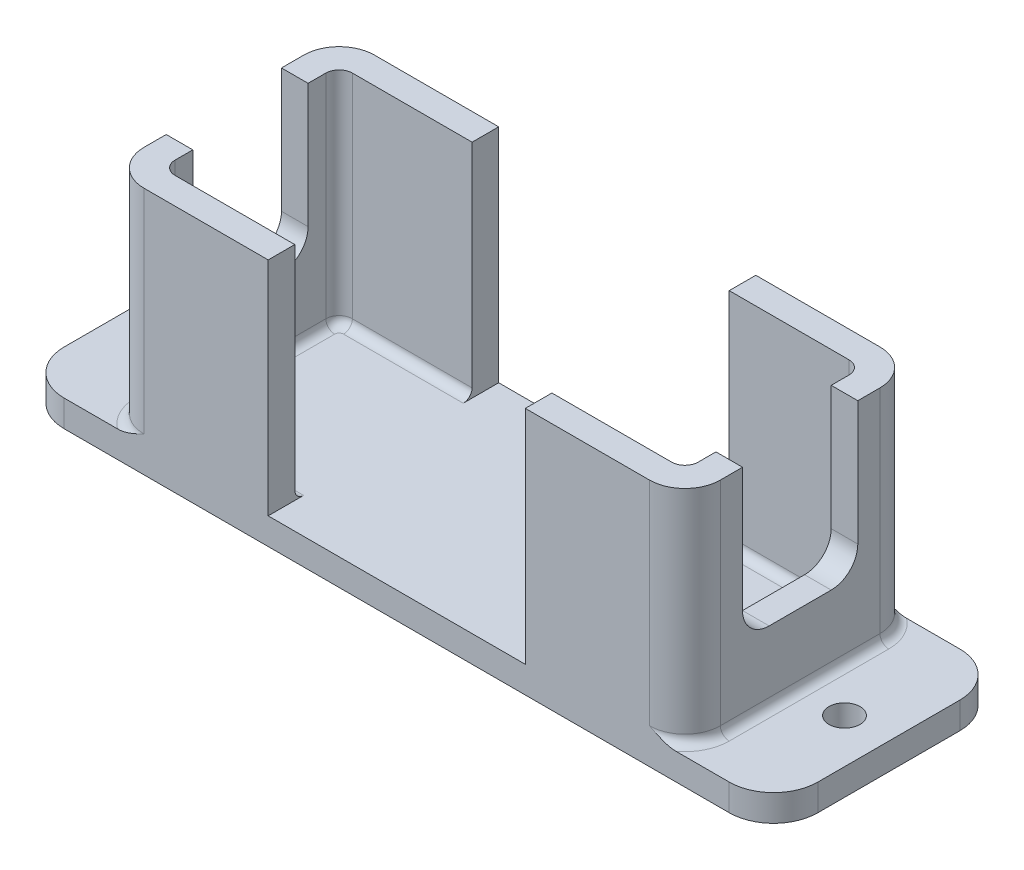
from build123d import *

# Parameters (mm, degrees)
SALIENTE_EXTRUIR1_DEPTH   = 25
SALIENTE_EXTRUIR1_2_DEPTH = 25
CROQUIS2_W                = 85
CROQUIS2_H                = 26
SALIENTE_EXTRUIR2_DEPTH   = 3
CROQUIS3_W                = 13
CROQUIS3_H                = 17
CORTAR_EXTRUIR2_DEPTH     = 81.118661996
REDONDEO1_R               = 5
REDONDEO2_R               = 3
REDONDEO3_R               = 3
REDONDEO4_R               = 1.5
REDONDEO5_R               = 4
REDONDEO6_R               = 4
REDONDEO7_R               = 1.5
CROQUIS5_R                = 1.75
CORTAR_EXTRUIR3_DEPTH     = 81.118661996
REDONDEO8_R               = 1
REDONDEO10_R              = 1


with BuildPart() as part:
    # Croquis1 → Saliente-Extruir1 (new body)
    with BuildSketch(Plane(origin=(0, 0, 0), x_dir=(1, 0, 0), z_dir=(0, 1, 0))):
        Polygon((0, -13), (0, 13), (18, 13), (18, 10), (3, 10), (3, -10), (18, -10), (18, -13), align=None)
    extrude(amount=SALIENTE_EXTRUIR1_DEPTH)

    # Croquis2 → Saliente-Extruir2 (add)
    with BuildSketch(Plane.XZ):
        with Locations((32.5, 0)):
            Rectangle(CROQUIS2_W, CROQUIS2_H)
    extrude(amount=SALIENTE_EXTRUIR2_DEPTH)


with BuildPart() as body_2:
    # Croquis1 → Saliente-Extruir1 2 (new body)
    with BuildSketch(Plane(origin=(0, 0, 0), x_dir=(1, 0, 0), z_dir=(0, 1, 0))):
        Polygon((47, -10), (47, -13), (65, -13), (65, 13), (47, 13), (47, 10), (62, 10), (62, -10), align=None)
    extrude(amount=SALIENTE_EXTRUIR1_2_DEPTH)


with BuildPart() as cortar_extruir2_tool:
    # Croquis3 → Cortar-Extruir2 (new, through all)
    with BuildSketch(Plane.ZY):
        with Locations((0, 16.5)):
            Rectangle(CROQUIS3_W, CROQUIS3_H)
    extrude(amount=-CORTAR_EXTRUIR2_DEPTH)


with BuildPart() as part_1:
    add(part.part)

    # Cortar-Extruir2: cut by cortar_extruir2_tool
    add(cortar_extruir2_tool.part, mode=Mode.SUBTRACT)

    # Redondeo1
    redondeo1_edges = [part_1.edges().sort_by_distance(p)[0] for p in [
        (-10, -1.5, 13),
        (-10, -1.5, -13),
        (75, -1.5, -13),
        (75, -1.5, 13),
    ]]
    fillet(redondeo1_edges, radius=REDONDEO1_R)

    # Redondeo2
    redondeo2_edges = [part_1.edges().sort_by_distance(p)[0] for p in [
        (1.5, 8, -6.5),
        (1.5, 8, 6.5),
    ]]
    fillet(redondeo2_edges, radius=REDONDEO2_R)

    # Redondeo4
    redondeo4_edges = [part_1.edges().sort_by_distance(p)[0] for p in [
        (3, 12.5, -10),
        (3, 12.5, 10),
    ]]
    fillet(redondeo4_edges, radius=REDONDEO4_R)

    # Redondeo5
    redondeo5_edges = [part_1.edges().sort_by_distance(p)[0] for p in [
        (0, 12.5, 13),
        (0, 12.5, -13),
    ]]
    fillet(redondeo5_edges, radius=REDONDEO5_R)

    # Croquis5 → Cortar-Extruir3 (cut, through all)
    with BuildSketch(Plane(origin=(0, 0, 0), x_dir=(1, 0, 0), z_dir=(0, 1, 0))):
        with Locations((70, 0)):
            Circle(CROQUIS5_R)
        with Locations((-5, 0)):
            Circle(CROQUIS5_R)
    extrude(amount=-CORTAR_EXTRUIR3_DEPTH, mode=Mode.SUBTRACT)


with BuildPart() as body_2_1:
    add(body_2.part)

    # Cortar-Extruir2: cut by cortar_extruir2_tool
    add(cortar_extruir2_tool.part, mode=Mode.SUBTRACT)

    # Redondeo3
    redondeo3_edges = [body_2_1.edges().sort_by_distance(p)[0] for p in [
        (63.5, 8, 6.5),
        (63.5, 8, -6.5),
    ]]
    fillet(redondeo3_edges, radius=REDONDEO3_R)

    # Redondeo6
    redondeo6_edges = [body_2_1.edges().sort_by_distance(p)[0] for p in [
        (65, 12.5, -13),
        (65, 12.5, 13),
    ]]
    fillet(redondeo6_edges, radius=REDONDEO6_R)

    # Redondeo7
    redondeo7_edges = [body_2_1.edges().sort_by_distance(p)[0] for p in [
        (62, 12.5, 10),
        (62, 12.5, -10),
    ]]
    fillet(redondeo7_edges, radius=REDONDEO7_R)


with BuildPart() as part_2:
    add(part_1.part)

    # Combinar1: union body 2
    add(body_2_1.part)

    # Redondeo8
    redondeo8_edges = [part_2.edges().sort_by_distance(p)[0] for p in [
        (63.828427125, 0, -11.828427125),
        (65, 0, 0),
        (63.828427125, 0, 11.828427125),
    ]]
    fillet(redondeo8_edges, radius=REDONDEO8_R)
    redondeo8_2_edges = [part_2.edges().sort_by_distance(p)[0] for p in [
        (0, 0, 0),
        (1.171572875, 0, -11.828427125),
        (1.171572875, 0, 11.828427125),
    ]]
    fillet(redondeo8_2_edges, radius=REDONDEO8_R)

    # Redondeo10
    redondeo10_edges = [part_2.edges().sort_by_distance(p)[0] for p in [
        (53.75, 0, -10),
        (61.560660172, 0, -9.560660172),
        (53.75, 0, 10),
        (61.560660172, 0, 9.560660172),
        (11.25, 0, 10),
        (3.439339828, 0, 9.560660172),
        (11.25, 0, -10),
        (3.439339828, 0, -9.560660172),
        (62, 0, 0),
        (3, 0, 0),
    ]]
    fillet(redondeo10_edges, radius=REDONDEO10_R)


solid = part_2.part
